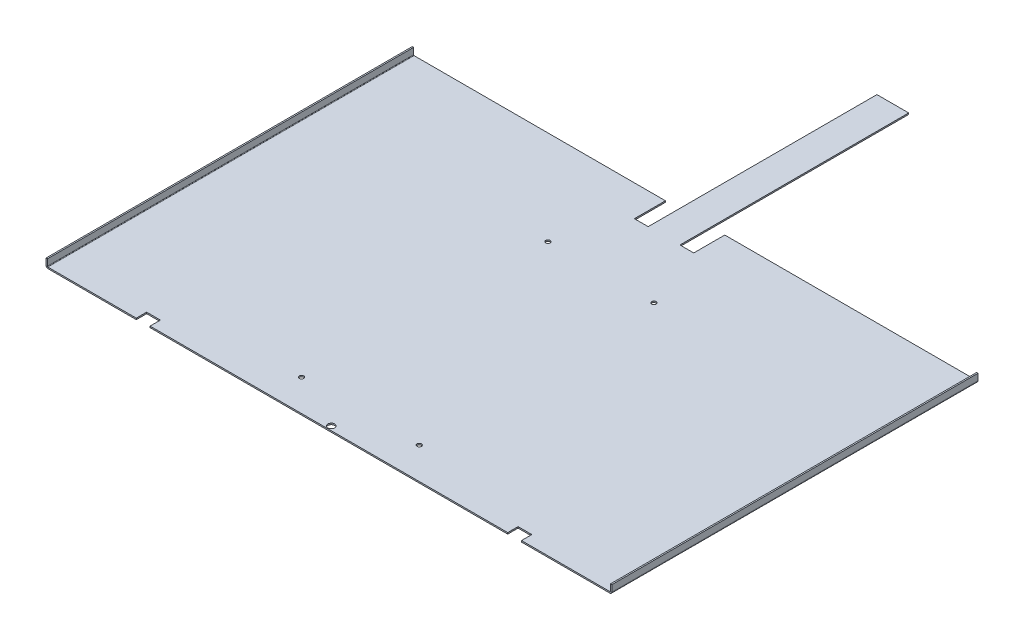
from build123d import *

# Parameters (mm, degrees)
SM_BASE_FLANGE_1_DEPTH             = 2
SM_EDGE_FLANGE_1_STRIP_W           = 9.48
SM_EDGE_FLANGE_1_STRIP_H           = 2
SM_EDGE_FLANGE_1_STRIP_CUT_DEPTH   = 530.740059044
SM_EDGE_FLANGE_1_STRIP_2_W         = 9.48
SM_EDGE_FLANGE_1_STRIP_2_H         = 2
SM_EDGE_FLANGE_1_STRIP_CUT_2_DEPTH = 530.740059044
SM_EDGE_FLANGE_1_DEPTH             = 530.740059044
SM_EDGE_FLANGE_1_BEND_DEPTH        = 530.740059044
SKETCH_12_R                        = 5
CUT_EXTRUDE_1_DEPTH                = 3
SKETCH_13_R                        = 3.25
CUT_EXTRUDE_2_DEPTH                = 5


# Read off the part's stored shape, not the designer's step: Базовая кромка1
# Sheet-metal steps are written as plain solids
with BuildPart() as part:
    # Базовая кромка1 outline → Базовая кромка1 (new body)
    with BuildSketch(Plane(origin=(0, 0, 0), x_dir=(1, 0, 0), z_dir=(0, 1, 0))):
        Polygon((-23, -331.526743508), (-43, -331.526743508), (-43, -286.526743508), (-410, -286.526743508), (-410, -817.266802552), (-279.163690552, -817.266802552), (-279.163690552, -802.266802552), (-259.163690552, -802.266802552), (-259.163690552, -817.266802552), (259.163690552, -817.266802552), (259.163690552, -802.266802552), (279.163690552, -802.266802552), (279.163690552, -817.266802552), (410, -817.266802552), (410, -286.526743508), (43, -286.526743508), (43, -331.526743508), (23, -331.526743508), (23, 0), (-23, 0), align=None)
    extrude(amount=SM_BASE_FLANGE_1_DEPTH)

    # Ребро-кромка1 strip (across the edge) → Ребро-кромка1 strip cut (cut)
    with BuildSketch(Plane(origin=(410, 2, 817.266802552), x_dir=(-1, 0, 0), z_dir=(0, 0, -1))):
        with Locations((-2, -1)):
            Rectangle(SM_EDGE_FLANGE_1_STRIP_W, SM_EDGE_FLANGE_1_STRIP_H)
    extrude(amount=SM_EDGE_FLANGE_1_STRIP_CUT_DEPTH, mode=Mode.SUBTRACT)

    # Ребро-кромка1 strip 2 (across the edge) → Ребро-кромка1 strip cut 2 (cut)
    with BuildSketch(Plane(origin=(-410, 2, 286.526743508), x_dir=(1, 0, 0), z_dir=(0, 0, 1))):
        with Locations((-2, -1)):
            Rectangle(SM_EDGE_FLANGE_1_STRIP_2_W, SM_EDGE_FLANGE_1_STRIP_2_H)
    extrude(amount=SM_EDGE_FLANGE_1_STRIP_CUT_2_DEPTH, mode=Mode.SUBTRACT)

    # Ребро-кромка1 section (across the edge) → Ребро-кромка1 (add)
    with BuildSketch(Plane(origin=(410, 2, 817.266802552), x_dir=(-1, 0, 0), z_dir=(0, 0, -1))):
        with BuildLine():
            Line((0, 0.74), (0, 10))
            Line((0, 10), (2, 10))
            Line((2, 10), (2, 0.74))
            ThreePointArc((2, 0.74), (2.216740982, 0.216740982), (2.74, 0))
            Line((2.74, 0), (2.74, -2))
            ThreePointArc((2.74, -2), (0.80252742, -1.19747258), (0, 0.74))
        make_face()
    extrude(amount=SM_EDGE_FLANGE_1_DEPTH)

    # Ребро-кромка1 section 2 (across the edge) → Ребро-кромка1 bend (add)
    with BuildSketch(Plane(origin=(-410, 2, 286.526743508), x_dir=(1, 0, 0), z_dir=(0, 0, 1))):
        with BuildLine():
            Line((0, 0.74), (0, 10))
            Line((0, 10), (2, 10))
            Line((2, 10), (2, 0.74))
            ThreePointArc((2, 0.74), (2.216740982, 0.216740982), (2.74, 0))
            Line((2.74, 0), (2.74, -2))
            ThreePointArc((2.74, -2), (0.80252742, -1.19747258), (0, 0.74))
        make_face()
    extrude(amount=SM_EDGE_FLANGE_1_BEND_DEPTH)

    # Эскиз12 → Вырез-Вытянуть1 (cut)
    with BuildSketch(Plane(origin=(0, 2, 0), x_dir=(1, 0, 0), z_dir=(0, 1, 0))):
        with Locations(Location((-2.5, -811.266802552, 0), (0, 0, 270))):
            Circle(SKETCH_12_R)
    extrude(amount=-CUT_EXTRUDE_1_DEPTH, mode=Mode.SUBTRACT)

    # Эскиз13 → Вырез-Вытянуть2 (cut)
    with BuildSketch(Plane(origin=(0, 2, 0), x_dir=(1, 0, 0), z_dir=(0, 1, 0))):
        with Locations(Location((76.777184185, -422.982246008, 0), (0, 0, 270))):
            Circle(SKETCH_13_R)
        with Locations(Location((85.329382087, -771.621076737, 0), (0, 0, 270))):
            Circle(SKETCH_13_R)
        with Locations(Location((-85.329382087, -771.621076737, 0), (0, 0, 270))):
            Circle(SKETCH_13_R)
        with Locations(Location((-76.777184185, -422.982246008, 0), (0, 0, 270))):
            Circle(SKETCH_13_R)
    extrude(amount=-CUT_EXTRUDE_2_DEPTH, mode=Mode.SUBTRACT)


solid = part.part
